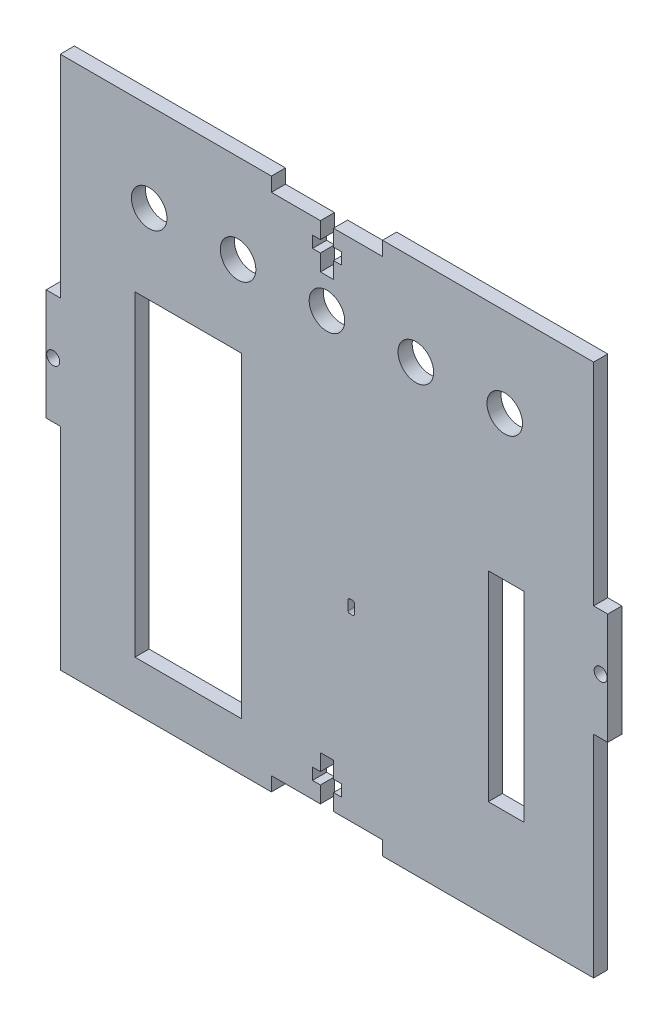
from build123d import *

# Parameters (mm, degrees)
SKETCH1_R           = 1.47
BOSS_EXTRUDE1_DEPTH = 1.5875
SKETCH3_W           = 8
SKETCH3_H           = 45
CUT_EXTRUDE1_DEPTH  = 88.184638842
SKETCH4_W           = 24
SKETCH4_H           = 71.2
CUT_EXTRUDE2_DEPTH  = 88.184638842
CUT_EXTRUDE4_DEPTH  = 88.184638842
SKETCH6_R           = 4
CUT_EXTRUDE5_DEPTH  = 88.184638842


with BuildPart() as part:
    # Sketch1 → Boss-Extrude1 (new, symmetric)
    with BuildSketch(Plane.XY):
        Polygon((-12.5, 60), (-60, 60), (-60, 12.5), (-63.175, 12.5), (-63.175, -12.5), (-60, -12.5), (-60, -60), (-12.5, -60), (-12.5, -56.825), (-1.47, -56.825), (-1.47, -53.125), (-3.25, -53.125), (-3.25, -50.525), (-1.47, -50.525), (-1.47, -46.825), (1.47, -46.825), (1.47, -50.525), (3.25, -50.525), (3.25, -53.125), (1.47, -53.125), (1.47, -56.825), (12.5, -56.825), (12.5, -60), (60, -60), (60, -12.5), (63.175, -12.5), (63.175, 12.5), (60, 12.5), (60, 60), (12.5, 60), (12.5, 56.825), (1.47, 56.825), (1.47, 53.125), (3.25, 53.125), (3.25, 50.525), (1.47, 50.525), (1.47, 46.825), (-1.47, 46.825), (-1.47, 50.525), (-3.25, 50.525), (-3.25, 53.125), (-1.47, 53.125), (-1.47, 56.825), (-12.5, 56.825), align=None)
        with Locations((61.5875, 0)):
            Circle(SKETCH1_R, mode=Mode.SUBTRACT)
        with Locations((-61.5875, 0)):
            Circle(SKETCH1_R, mode=Mode.SUBTRACT)
    extrude(amount=BOSS_EXTRUDE1_DEPTH, both=True)

    # Sketch3 → Cut-Extrude1 (cut, through all)
    with BuildSketch(Plane(origin=(0, 0, -1.5875), x_dir=(-1, 0, 0), z_dir=(0, 0, -1))):
        with Locations((-40.3, -15)):
            Rectangle(SKETCH3_W, SKETCH3_H)
    extrude(amount=-CUT_EXTRUDE1_DEPTH, mode=Mode.SUBTRACT)

    # Sketch4 → Cut-Extrude2 (cut, through all)
    with BuildSketch(Plane(origin=(0, 0, -1.5875), x_dir=(-1, 0, 0), z_dir=(0, 0, -1))):
        with Locations((31.2, -13.494459363)):
            Rectangle(SKETCH4_W, SKETCH4_H)
    extrude(amount=-CUT_EXTRUDE2_DEPTH, mode=Mode.SUBTRACT)

    # Sketch5 → Cut-Extrude4 (cut, through all)
    with BuildSketch(Plane(origin=(0, 0, -1.5875), x_dir=(-1, 0, 0), z_dir=(0, 0, -1))):
        with BuildLine():
            Line((-5.153420736, -16.45), (-5.77915134, -16.45))
            ThreePointArc((-5.77915134, -16.45), (-6.043498683, -16.350200736), (-6.175937675, -16.10060241))
            ThreePointArc((-6.175937675, -16.10060241), (-6.245834875, -15), (-6.175937675, -13.89939759))
            ThreePointArc((-6.175937675, -13.89939759), (-6.043498683, -13.649799264), (-5.77915134, -13.55))
            Line((-5.77915134, -13.55), (-5.153420736, -13.55))
            ThreePointArc((-5.153420736, -13.55), (-4.870578023, -13.667157288), (-4.753420736, -13.95))
            Line((-4.753420736, -13.95), (-4.753420736, -16.05))
            ThreePointArc((-4.753420736, -16.05), (-4.870578023, -16.332842712), (-5.153420736, -16.45))
        make_face()
    extrude(amount=-CUT_EXTRUDE4_DEPTH, mode=Mode.SUBTRACT)

    # Sketch6 → Cut-Extrude5 (cut, through all)
    with BuildSketch(Plane(origin=(0, 0, -1.5875), x_dir=(-1, 0, 0), z_dir=(0, 0, -1))):
        with Locations((40, 40)):
            Circle(SKETCH6_R)
        with Locations((20, 40)):
            Circle(SKETCH6_R)
        with Locations((0, 40)):
            Circle(SKETCH6_R)
        with Locations((-20, 40)):
            Circle(SKETCH6_R)
        with Locations((-40, 40)):
            Circle(SKETCH6_R)
    extrude(amount=-CUT_EXTRUDE5_DEPTH, mode=Mode.SUBTRACT)


solid = part.part
